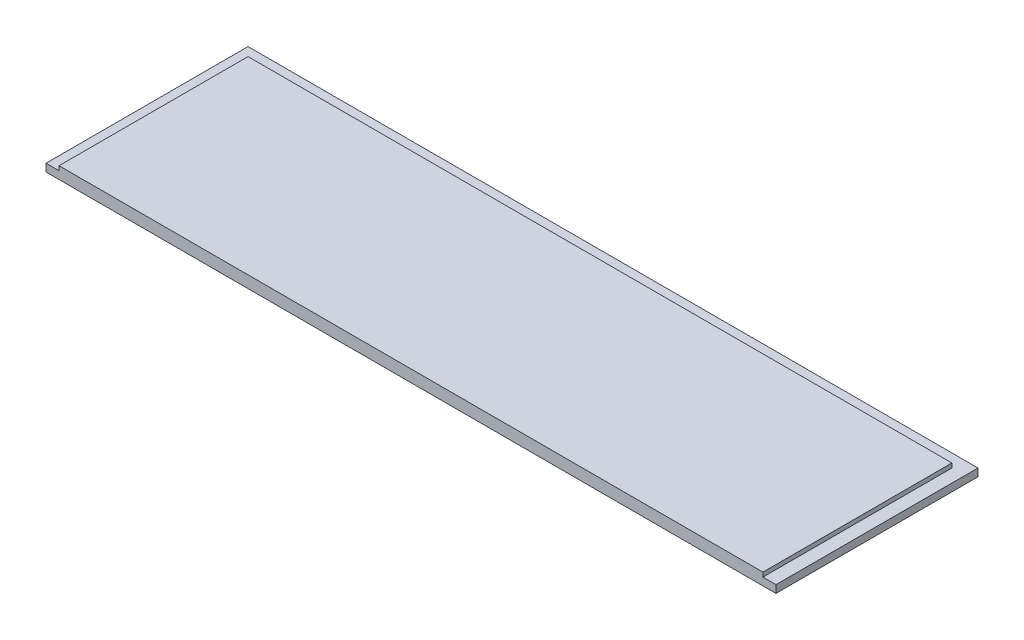
from build123d import *

# Parameters (mm, degrees)
SKETCH1_W           = 1066.8
SKETCH1_H           = 295.275
BOSS_EXTRUDE1_DEPTH = 17.4752
CUT_EXTRUDE1_DEPTH  = 6.35


with BuildPart() as part:
    # Sketch1 → Boss-Extrude1 (new body)
    with BuildSketch(Plane(origin=(0, 0, 0), x_dir=(1, 0, 0), z_dir=(0, 1, 0))):
        Rectangle(SKETCH1_W, SKETCH1_H)
    extrude(amount=BOSS_EXTRUDE1_DEPTH)

    # Sketch2 → Cut-Extrude1 (cut)
    with BuildSketch(Plane(origin=(0, 17.4752, 0), x_dir=(1, 0, 0), z_dir=(0, 1, 0))):
        Polygon((-533.4, -147.6375), (-514.35, -147.6375), (-514.35, 128.5875), (514.35, 128.5875), (514.35, -147.6375), (533.4, -147.6375), (533.4, 147.6375), (-533.4, 147.6375), align=None)
    extrude(amount=-CUT_EXTRUDE1_DEPTH, mode=Mode.SUBTRACT)


solid = part.part
